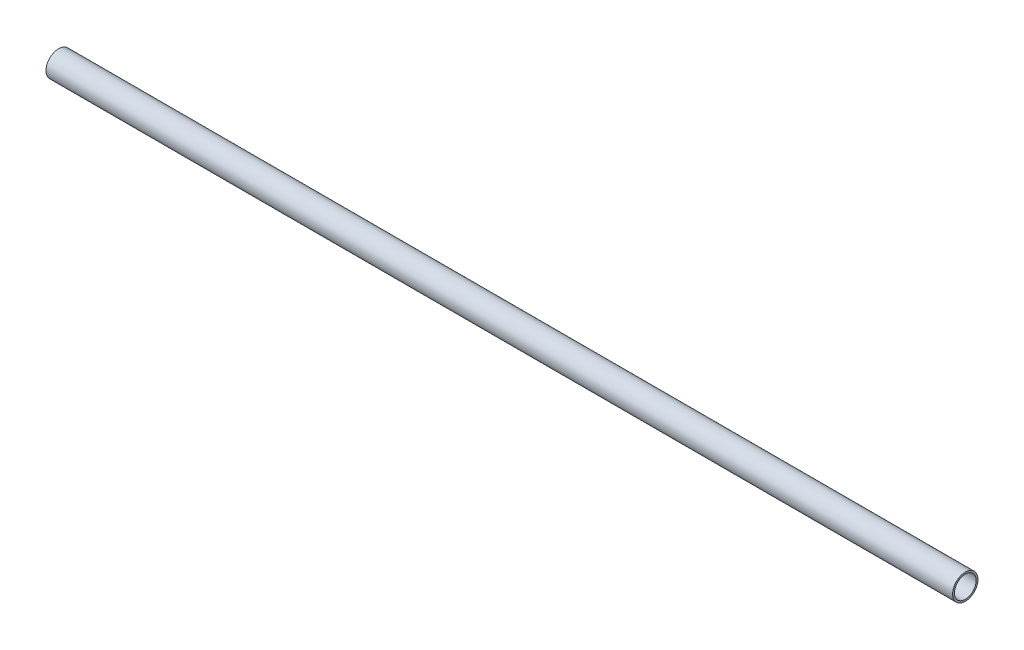
from build123d import *

# Parameters (mm, degrees)
IZIM1_R                     = 7
IZIM1_R_2                   = 6
Y_KSEKLIK_EKSTR_ZYON1_DEPTH = 250


with BuildPart() as part:
    # Çizim1 → Yükseklik-Ekstrüzyon1 (new, symmetric)
    with BuildSketch(Plane(origin=(0, 0, 0), x_dir=(0, 0, -1), z_dir=(1, 0, 0))):
        Circle(IZIM1_R)
        Circle(IZIM1_R_2, mode=Mode.SUBTRACT)
    extrude(amount=Y_KSEKLIK_EKSTR_ZYON1_DEPTH, both=True)


solid = part.part
